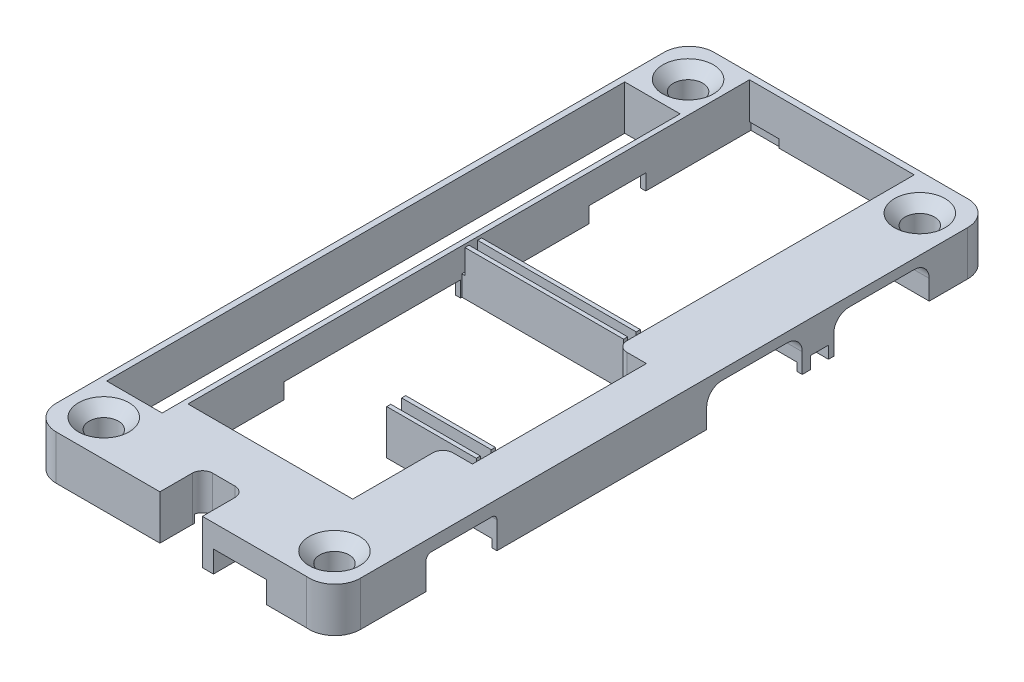
from build123d import *

# Parameters (mm, degrees)
BOSS_EXTRUDE1_DEPTH                                  = 4.4
CUT_EXTRUDE1_START                                   = 6
CUT_EXTRUDE1_DEPTH                                   = 2.4
CUT_EXTRUDE2_DEPTH                                   = 37.078029775
CUT_EXTRUDE2_DEPTH_BACK                              = 37.078029775
SKETCH3_W                                            = 5.48
SKETCH3_H                                            = 51.2
SKETCH10_W                                           = 16.283333333
SKETCH10_H                                           = 26.775676
CUT_EXTRUDE3_DEPTH                                   = 36.889054494
CUT_EXTRUDE4_DEPTH                                   = 7.151746667
CUT_EXTRUDE5_START                                   = 0.1
SKETCH12_W                                           = 13.500228
SKETCH12_H                                           = 12.700128
CUT_EXTRUDE5_DEPTH                                   = 36.989054494
CUT_EXTRUDE6_START                                   = 0.2
SKETCH13_W                                           = 0.5
SKETCH13_H                                           = 17.440404
SKETCH13_H_2                                         = 5.5901
SKETCH13_W_2                                         = 2.916666667
SKETCH13_H_3                                         = 0.961103333
SKETCH13_W_3                                         = 2.421802
SKETCH13_H_4                                         = 1.8
SKETCH13_W_4                                         = 3.499868
SKETCH13_H_5                                         = 3.499868
CUT_EXTRUDE6_DEPTH                                   = 37.138374093
SKETCH14_W                                           = 5.250054
SKETCH14_H                                           = 2.4
CUT_EXTRUDE7_DEPTH                                   = 4.223132
CUT_EXTRUDE8_DEPTH                                   = 37.078029775
CUT_EXTRUDE9_START                                   = 0.2
SKETCH16_W                                           = 2.927402
SKETCH16_H                                           = 0.136274
SKETCH16_W_2                                         = 0.724468667
SKETCH16_H_2                                         = 3.324
SKETCH16_W_3                                         = 6.061278
SKETCH16_H_3                                         = 2.564974001
CUT_EXTRUDE9_DEPTH                                   = 37.209779678
FILLET1_R                                            = 0.5
SKETCH17_W                                           = 1.77
SKETCH17_H                                           = 1.4652
CUT_EXTRUDE10_DEPTH                                  = 3.835528
SKETCH18_W                                           = 8.852598
SKETCH18_H                                           = 0.4
SKETCH18_W_2                                         = 15.683333333
BOSS_EXTRUDE2_DEPTH                                  = 2.4
CSK_FOR_M2_5_SLOTTED_RAISED_CTSK_HEAD_SC_D           = 2.9
CSK_FOR_M2_5_SLOTTED_RAISED_CTSK_HEAD_SC_CSINK_D     = 5
CSK_FOR_M2_5_SLOTTED_RAISED_CTSK_HEAD_SC_CSINK_ANGLE = 90


with BuildPart() as part:
    # Sketch1 → Boss-Extrude1 (new body)
    with BuildSketch(Plane(origin=(0, 1.6, 0), x_dir=(1, 0, 0), z_dir=(0, 1, 0))):
        with BuildLine():
            Line((-15.002764, 30.021276), (-15.002764, -30.043374))
            ThreePointArc((-15.002764, -30.043374), (-14.282828873, -31.781068474), (-12.54506, -32.500824))
            Line((-12.54506, -32.500824), (12.200382, -32.500824))
            ThreePointArc((12.200382, -32.500824), (14.163585126, -31.860357898), (15.002764, -29.973524))
            Line((15.002764, -29.973524), (15.002764, 30.0355))
            ThreePointArc((15.002764, 30.0355), (14.280687318, 31.778747318), (12.53744, 32.500824))
            Line((12.53744, 32.500824), (-12.522962, 32.500824))
            ThreePointArc((-12.522962, 32.500824), (-14.276432231, 31.77467184), (-15.002764, 30.021276))
        make_face()
    extrude(amount=BOSS_EXTRUDE1_DEPTH)

    # Sketch2 → Cut-Extrude1 (cut)
    with BuildSketch(Plane(origin=(0, 0, 0), x_dir=(1, 0, 0), z_dir=(0, 1, 0)).offset(CUT_EXTRUDE1_START)):
        with BuildLine():
            Line((-8.432316, 31.600824), (-8.432316, 31.900824))
            Line((-8.432316, 31.900824), (7.851017333, 31.900824))
            Line((7.851017333, 31.900824), (7.851017333, 31.600824))
            Line((7.851017333, 31.600824), (7.851017333, 3.517490667))
            ThreePointArc((7.851017333, 3.517490667), (8.143910552, 2.810383885), (8.851017333, 2.517490667))
            Line((8.851017333, 2.517490667), (10.767684, 2.517490667))
            Line((10.767684, 2.517490667), (10.767684, -14.682509333))
            Line((10.767684, -14.682509333), (8.851017333, -14.682509333))
            ThreePointArc((8.851017333, -14.682509333), (8.143910552, -14.975402552), (7.851017333, -15.682509333))
            Line((7.851017333, -15.682509333), (7.851017333, -23.599176))
            Line((7.851017333, -23.599176), (-8.432316, -23.599176))
            Line((-8.432316, -23.599176), (-8.432316, 31.600824))
        make_face()
    extrude(amount=-CUT_EXTRUDE1_DEPTH, mode=Mode.SUBTRACT)

    # Sketch3 → Cut-Extrude2 (cut, two sides: drawn at the far end of the back side and taken through both)
    with BuildSketch(Plane(origin=(0, 6, 0), x_dir=(1, 0, 0), z_dir=(0, 1, 0)).offset(-CUT_EXTRUDE2_DEPTH_BACK)):
        with Locations((-11.672316, -0.0508)):
            Rectangle(SKETCH3_W, SKETCH3_H)
    extrude(amount=CUT_EXTRUDE2_DEPTH + CUT_EXTRUDE2_DEPTH_BACK, mode=Mode.SUBTRACT)

    # Sketch10 → Cut-Extrude3 (cut, through all)
    with BuildSketch(Plane(origin=(0, 3.6, 0), x_dir=(1, 0, 0), z_dir=(0, 1, 0))):
        with Locations((-0.290649333, 18.512986)):
            Rectangle(SKETCH10_W, SKETCH10_H)
        with BuildLine():
            Line((-8.432316, 3.478594), (7.851017333, 3.478594))
            Line((7.851017333, 3.478594), (7.851017333, 3.517490667))
            ThreePointArc((7.851017333, 3.517490667), (8.143910552, 2.810383885), (8.851017333, 2.517490667))
            Line((8.851017333, 2.517490667), (10.767684, 2.517490667))
            Line((10.767684, 2.517490667), (10.767684, -12.121198))
            Line((10.767684, -12.121198), (1.615086, -12.121198))
            Line((1.615086, -12.121198), (1.615086, -13.998638))
            Line((1.615086, -13.998638), (10.767684, -13.998638))
            Line((10.767684, -13.998638), (10.767684, -14.682509333))
            Line((10.767684, -14.682509333), (8.851017333, -14.682509333))
            ThreePointArc((8.851017333, -14.682509333), (8.143910552, -14.975402552), (7.851017333, -15.682509333))
            Line((7.851017333, -15.682509333), (7.851017333, -23.599176))
            Line((7.851017333, -23.599176), (-8.432316, -23.599176))
            Line((-8.432316, -23.599176), (-8.432316, 3.478594))
        make_face()
    extrude(amount=-CUT_EXTRUDE3_DEPTH, mode=Mode.SUBTRACT)

    # Sketch11 → Cut-Extrude4 (cut)
    with BuildSketch(Plane(origin=(15.002764, 0, 0), x_dir=(0, 0, -1), z_dir=(1, 0, 0))):
        with BuildLine():
            Line((-23.494304, 1.6), (-16.494304, 1.6))
            Line((-16.494304, 1.6), (-16.494304, 4.25))
            ThreePointArc((-16.494304, 4.25), (-16.640750609, 4.603553391), (-16.994304, 4.75))
            Line((-16.994304, 4.75), (-22.994304, 4.75))
            ThreePointArc((-22.994304, 4.75), (-23.347857391, 4.603553391), (-23.494304, 4.25))
            Line((-23.494304, 4.25), (-23.494304, 1.6))
        make_face()
        with BuildLine():
            Line((4.238924, 1.6), (13.678923999, 1.6))
            Line((13.678923999, 1.6), (13.678923999, 3.55))
            ThreePointArc((13.678923999, 3.55), (13.239584171, 4.610660172), (12.178923999, 5.05))
            Line((12.178923999, 5.05), (5.738924, 5.05))
            ThreePointArc((5.738924, 5.05), (4.678263828, 4.610660172), (4.238924, 3.55))
            Line((4.238924, 3.55), (4.238924, 1.6))
        make_face()
        with BuildLine():
            Line((16.795424, 1.6), (26.230423999, 1.6))
            Line((26.230423999, 1.6), (26.230423999, 3.55))
            ThreePointArc((26.230423999, 3.55), (25.791084171, 4.610660172), (24.730423999, 5.05))
            Line((24.730423999, 5.05), (18.295424, 5.05))
            ThreePointArc((18.295424, 5.05), (17.234763828, 4.610660172), (16.795424, 3.55))
            Line((16.795424, 3.55), (16.795424, 1.6))
        make_face()
    extrude(amount=-CUT_EXTRUDE4_DEPTH, mode=Mode.SUBTRACT)

    # Sketch12 → Cut-Extrude5 (cut, through all)
    with BuildSketch(Plane(origin=(0, 3.6, 0), x_dir=(1, 0, 0), z_dir=(0, 1, 0)).offset(CUT_EXTRUDE5_START)):
        with Locations((-1.521714, -20.348702)):
            Rectangle(SKETCH12_W, SKETCH12_H)
    extrude(amount=-CUT_EXTRUDE5_DEPTH, mode=Mode.SUBTRACT)

    # Sketch13 → Cut-Extrude6 (cut, through all)
    with BuildSketch(Plane(origin=(0, 2.95, 0), x_dir=(1, 0, 0), z_dir=(0, 1, 0)).offset(CUT_EXTRUDE6_START)):
        with Locations((-8.682316, -5.382704)):
            Rectangle(SKETCH13_W, SKETCH13_H)
        Polygon((8.359486, -27.717306), (8.359486, -26.20092), (14.002764, -26.20092), (14.002764, -23.494304), (8.359486, -23.494304), (5.2284, -23.494304), (5.2284, -27.717306), align=None)
        with Locations((-8.682316, 18.856548)):
            Rectangle(SKETCH13_W, SKETCH13_H_2)
        with Locations((9.309350667, 2.998042333)):
            Rectangle(SKETCH13_W_2, SKETCH13_H_3)
        with Locations((11.978585, -1.120902)):
            Rectangle(SKETCH13_W_3, SKETCH13_H_4)
        with Locations((12.702286, -7.572502)):
            Rectangle(SKETCH13_W_4, SKETCH13_H_5)
    extrude(amount=-CUT_EXTRUDE6_DEPTH, mode=Mode.SUBTRACT)

    # Sketch14 → Cut-Extrude7 (cut)
    with BuildSketch(Plane.XY.offset(32.500824)):
        with Locations((5.615305, 2.55)):
            Rectangle(SKETCH14_W, SKETCH14_H)
    extrude(amount=-CUT_EXTRUDE7_DEPTH, mode=Mode.SUBTRACT)

    # Sketch15 → Cut-Extrude8 (cut, through all)
    with BuildSketch(Plane(origin=(0, 6, 0), x_dir=(1, 0, 0), z_dir=(0, 1, 0))):
        with BuildLine():
            Line((-2.297236, -32.500824), (1.902764, -32.500824))
            Line((1.902764, -32.500824), (1.902764, -29.300824))
            ThreePointArc((1.902764, -29.300824), (1.609870781, -28.593717219), (0.902764, -28.300824))
            Line((0.902764, -28.300824), (-1.297236, -28.300824))
            ThreePointArc((-1.297236, -28.300824), (-2.004342781, -28.593717219), (-2.297236, -29.300824))
            Line((-2.297236, -29.300824), (-2.297236, -32.500824))
        make_face()
    extrude(amount=-CUT_EXTRUDE8_DEPTH, mode=Mode.SUBTRACT)

    # Sketch16 → Cut-Extrude9 (cut, through all)
    with BuildSketch(Plane(origin=(0, 2.2, 0), x_dir=(1, 0, 0), z_dir=(0, 1, 0)).offset(CUT_EXTRUDE9_START)):
        with Locations((-6.968615, 31.968961)):
            Rectangle(SKETCH16_W, SKETCH16_H)
        Polygon((-8.011314, -27.953702), (-8.011314, -26.698766), (8.240332, -26.698766), (8.240332, -29.100824), (-3.976114, -29.100824), (-3.976114, -31.787302), (-8.011314, -31.787302), align=None)
        with Locations((8.213251666, 28.243098)):
            Rectangle(SKETCH16_W_2, SKETCH16_H_2)
        with Locations((11.472125, 14.961410999)):
            Rectangle(SKETCH16_W_3, SKETCH16_H_3)
        Polygon((7.851017333, 3.478594), (14.502764, 3.478594), (14.502764, -16.494304), (7.851017333, -16.494304), (7.851017333, -13.998638), (10.767684, -13.998638), (10.767684, -12.121198), (7.851017333, -12.121198), align=None)
    extrude(amount=-CUT_EXTRUDE9_DEPTH, mode=Mode.SUBTRACT)

    # Fillet1
    # the kernel refuses this fillet: 0.5 mm, written as the material it adds along each edge
    with BuildSketch(Plane(origin=(7.851017333, 3.55, -5.738924), x_dir=(0, 0.762179368611119, 0.6473659012209063), z_dir=(0, 0.6473659012209063, -0.762179368611119))) as fillet1_piece_1_section:
        with BuildLine():
            CenterArc((1.5 - FILLET1_R, FILLET1_R), FILLET1_R, 270, 90)
            Line((1.5, FILLET1_R), (1.5, 0))
            Line((1.5, 0), (1.5 - FILLET1_R, 0))
        make_face()
    fillet1_piece_1 = revolve(axis=Axis((7.851017333, 3.55, -5.738924), (1, 0, 0)), revolution_arc=49.656704737, mode=Mode.PRIVATE)
    fillet1_piece_1 = split(fillet1_piece_1, bisect_by=Plane(origin=(7.962700871, 3.6, -4.350907081), z_dir=(0, -1, 0)), keep=Keep.TOP, mode=Mode.PRIVATE)
    add(fillet1_piece_1)
    with BuildSketch(Plane(origin=(7.851017333, 3.55, -4.238924), x_dir=(1, 0, 0), z_dir=(0, -1, 0))) as fillet1_piece_2:
        with BuildLine():
            CenterArc((FILLET1_R, -FILLET1_R), FILLET1_R, 90, 90)
            Line((0, -FILLET1_R), (0, 0))
            Line((0, 0), (FILLET1_R, 0))
        make_face()
    extrude(amount=1.95)

    # Sketch17 → Cut-Extrude10 (cut)
    with BuildSketch(Plane(origin=(15.002764, 0, 0), x_dir=(0, 0, -1), z_dir=(1, 0, 0))):
        with Locations((15.389098, 2.0826)):
            Rectangle(SKETCH17_W, SKETCH17_H)
    extrude(amount=-CUT_EXTRUDE10_DEPTH, mode=Mode.SUBTRACT)

    # Sketch18 → Boss-Extrude2 (add)
    with BuildSketch(Plane(origin=(0, 3.6, 0), x_dir=(1, 0, 0), z_dir=(0, 1, 0))):
        with Locations((6.041385, -12.321198)):
            Rectangle(SKETCH18_W, SKETCH18_H)
        with Locations((6.041385, -13.798638)):
            Rectangle(SKETCH18_W, SKETCH18_H)
        with Locations((-0.290649334, 4.925148)):
            Rectangle(SKETCH18_W_2, SKETCH18_H)
        with Locations((-0.290649334, 3.678594)):
            Rectangle(SKETCH18_W_2, SKETCH18_H)
    extrude(amount=BOSS_EXTRUDE2_DEPTH)

    # CSK for M2.5 Slotted raised CTSK head screws1 (through all)
    with Locations(Plane(origin=(0, 6, 0), x_dir=(1, 0, 0), z_dir=(0, 1, 0))):
        with Locations((-11.49731, 28.899104), (11.402822, 28.899104), (-11.447272, -28.900882), (11.402822, -28.95092)):
            CounterSinkHole(CSK_FOR_M2_5_SLOTTED_RAISED_CTSK_HEAD_SC_D / 2, CSK_FOR_M2_5_SLOTTED_RAISED_CTSK_HEAD_SC_CSINK_D / 2, counter_sink_angle=CSK_FOR_M2_5_SLOTTED_RAISED_CTSK_HEAD_SC_CSINK_ANGLE)


solid = part.part
